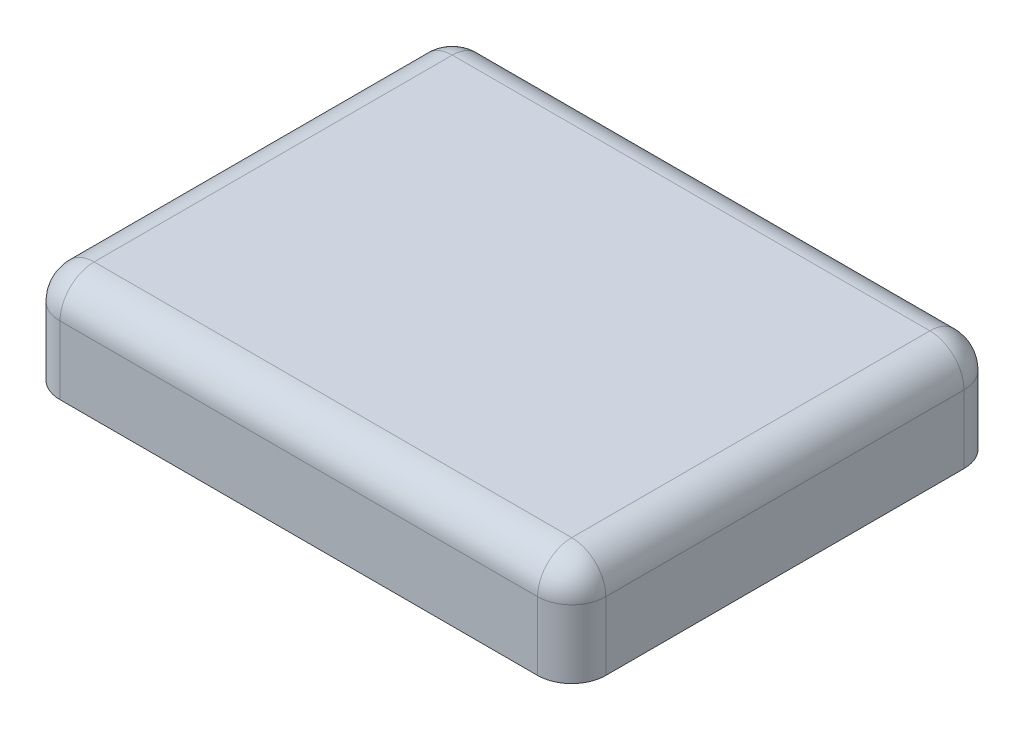
from build123d import *

# Parameters (mm, degrees)
BASES_W    = 3.2
BASES_H    = 2.5
BASE_DEPTH = 0.6
SIDEF_R    = 0.2
TOPF_R     = 0.2


with BuildPart() as part:
    # BaseS → Base (new body)
    with BuildSketch(Plane(origin=(0, 0, 0), x_dir=(1, 0, 0), z_dir=(0, 1, 0))):
        Rectangle(BASES_W, BASES_H)
    extrude(amount=BASE_DEPTH)

    # SideF
    sidef_edges = [part.edges().sort_by_distance(p)[0] for p in [
        (1.6, 0.3, 1.25),
        (1.6, 0.3, -1.25),
        (-1.6, 0.3, 1.25),
        (-1.6, 0.3, -1.25),
    ]]
    fillet(sidef_edges, radius=SIDEF_R)

    # TopF
    topf_edges = [part.edges().sort_by_distance(p)[0] for p in [
        (-1.541421356, 0.6, 1.191421356),
        (-1.6, 0.6, 0),
        (-1.541421356, 0.6, -1.191421356),
        (0, 0.6, -1.25),
        (1.541421356, 0.6, -1.191421356),
        (1.6, 0.6, 0),
        (1.541421356, 0.6, 1.191421356),
        (0, 0.6, 1.25),
    ]]
    fillet(topf_edges, radius=TOPF_R)


solid = part.part
